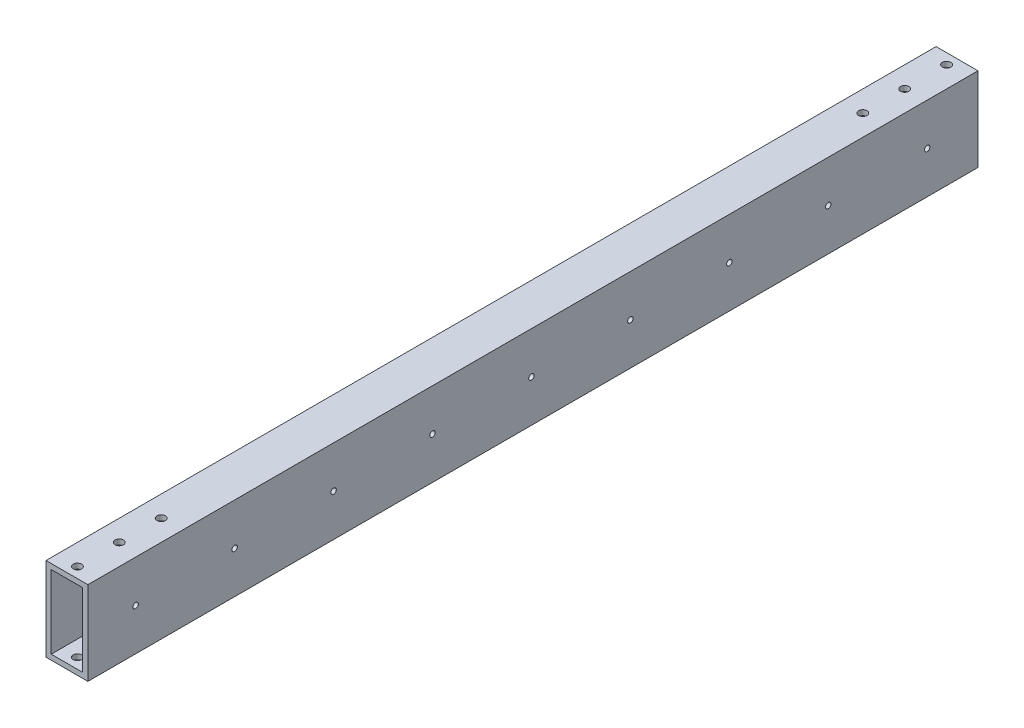
from build123d import *

# Parameters (mm, degrees)
SKETCH1_W                           = 25.4
SKETCH1_H                           = 50.8
SKETCH1_W_2                         = 19.05
SKETCH1_H_2                         = 44.45
EXTRUDE_THIN1_DEPTH                 = 539.75
F_10_CLEARANCE_HOLE2_D              = 5.1054
M4X0_7_TAPPED_HOLE1_D               = 3.3
M4X0_7_TAPPED_HOLE1_DEPTH           = 3.175
F_1_8_START                         = -25.4
F_1_8_0_13_DIAMETER_HOLE1_OUTLINE_R = 1.651
F_1_8_0_13_DIAMETER_HOLE1_DEPTH     = 3.175


# Read off the part's stored shape, not the designer's step: 1/8 (0.13) Diameter Hole1
with BuildPart() as part:
    # Sketch1 → Extrude-Thin1 (new body)
    with BuildSketch(Plane.XY):
        Rectangle(SKETCH1_W, SKETCH1_H)
        Rectangle(SKETCH1_W_2, SKETCH1_H_2, mode=Mode.SUBTRACT)
    extrude(amount=EXTRUDE_THIN1_DEPTH)

    # #10 Clearance Hole2 (through all)
    with Locations(Plane(origin=(0, 25.4, 0), x_dir=(1, 0, 0), z_dir=(0, 1, 0))):
        with Locations((0, -533.4), (0, -508), (0, -482.6), (0, -6.35), (0, -31.75), (0, -57.15)):
            Hole(F_10_CLEARANCE_HOLE2_D / 2)

    # M4x0.7 Tapped Hole1
    with Locations(Plane(origin=(12.7, 0, 0), x_dir=(0, 0, -1), z_dir=(1, 0, 0))):
        with Locations((-390.782, 0), (-450.782, 0), (-510.782, 0), (-330.782, 0), (-270.782, 0), (-210.782, 0), (-150.782, 0), (-90.782, 0), (-30.782, 0)):
            Hole(M4X0_7_TAPPED_HOLE1_D / 2, depth=M4X0_7_TAPPED_HOLE1_DEPTH)

    # 1/8 (0.13) Diameter Hole1 outline → 1/8 (0.13) Diameter Hole1 (cut)
    with BuildSketch(Plane(origin=(0, 0, 0), x_dir=(1, 0, 0), z_dir=(0, 1, 0)).offset(F_1_8_START)):
        with Locations((3.175, -70.358)):
            Circle(F_1_8_0_13_DIAMETER_HOLE1_OUTLINE_R)
        with Locations((-3.175, -95.758)):
            Circle(F_1_8_0_13_DIAMETER_HOLE1_OUTLINE_R)
        with Locations((3.175, -127.508)):
            Circle(F_1_8_0_13_DIAMETER_HOLE1_OUTLINE_R)
        with Locations((-3.175, -152.908)):
            Circle(F_1_8_0_13_DIAMETER_HOLE1_OUTLINE_R)
        with Locations((3.175, -184.658)):
            Circle(F_1_8_0_13_DIAMETER_HOLE1_OUTLINE_R)
        with Locations((-3.175, -210.058)):
            Circle(F_1_8_0_13_DIAMETER_HOLE1_OUTLINE_R)
        with Locations((3.175, -241.808)):
            Circle(F_1_8_0_13_DIAMETER_HOLE1_OUTLINE_R)
        with Locations((-3.175, -267.208)):
            Circle(F_1_8_0_13_DIAMETER_HOLE1_OUTLINE_R)
        with Locations((3.175, -298.958)):
            Circle(F_1_8_0_13_DIAMETER_HOLE1_OUTLINE_R)
        with Locations((-3.175, -324.358)):
            Circle(F_1_8_0_13_DIAMETER_HOLE1_OUTLINE_R)
        with Locations((3.175, -356.108)):
            Circle(F_1_8_0_13_DIAMETER_HOLE1_OUTLINE_R)
        with Locations((-3.175, -381.508)):
            Circle(F_1_8_0_13_DIAMETER_HOLE1_OUTLINE_R)
        with Locations((3.175, -413.258)):
            Circle(F_1_8_0_13_DIAMETER_HOLE1_OUTLINE_R)
        with Locations((-3.175, -438.658)):
            Circle(F_1_8_0_13_DIAMETER_HOLE1_OUTLINE_R)
        with Locations((3.175, -470.408)):
            Circle(F_1_8_0_13_DIAMETER_HOLE1_OUTLINE_R)
    extrude(amount=F_1_8_0_13_DIAMETER_HOLE1_DEPTH, mode=Mode.SUBTRACT)


solid = part.part
